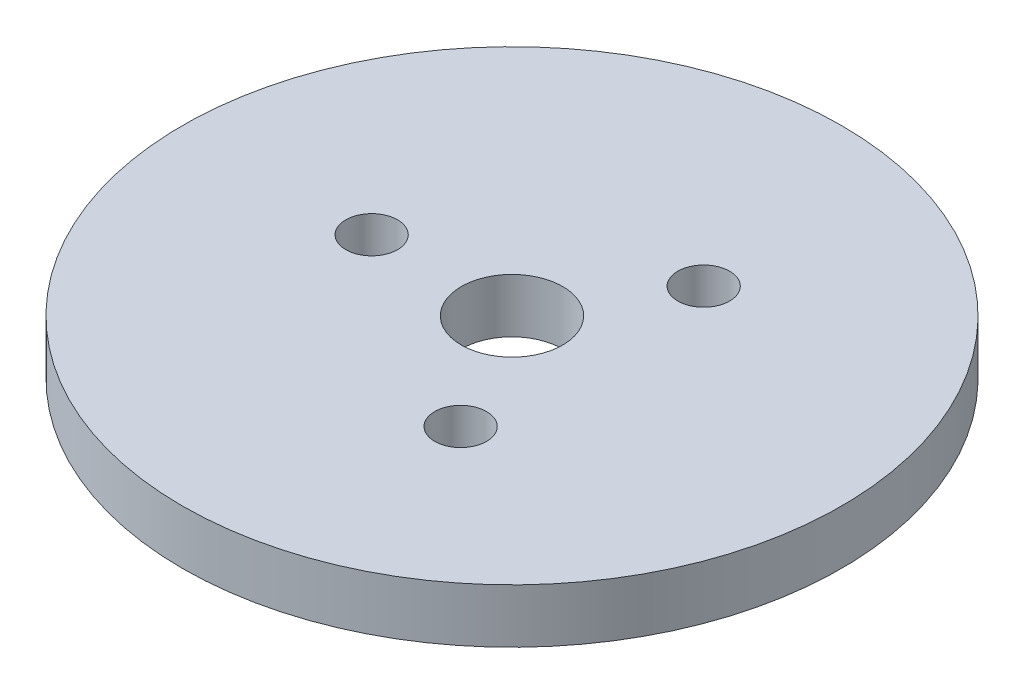
from build123d import *

# Parameters (mm, degrees)
SKETCH1_R           = 97.5
BOSS_EXTRUDE1_DEPTH = 16
SKETCH2_R           = 15
CUT_EXTRUDE1_DEPTH  = 139.811022617
SKETCH3_R           = 7.663290613
CUT_EXTRUDE2_DEPTH  = 11.331991897
CIRPATTERN1_COUNT   = 3


with BuildPart() as part:
    # Sketch1 → Boss-Extrude1 (new body)
    with BuildSketch(Plane(origin=(0, 0, 0), x_dir=(1, 0, 0), z_dir=(0, 1, 0))):
        Circle(SKETCH1_R)
    extrude(amount=BOSS_EXTRUDE1_DEPTH)

    # Sketch2 → Cut-Extrude1 (cut, through all)
    with BuildSketch(Plane(origin=(0, 0, 0), x_dir=(1, 0, 0), z_dir=(0, 1, 0))):
        Circle(SKETCH2_R)
    extrude(amount=CUT_EXTRUDE1_DEPTH, mode=Mode.SUBTRACT)

    # Sketch3 → Cut-Extrude2 (cut)
    with BuildSketch(Plane(origin=(0, 16, 0), x_dir=(1, 0, 0), z_dir=(0, 1, 0))):
        with Locations((-41.520688626, 0)):
            Circle(SKETCH3_R)
    cut_extrude2 = extrude(amount=-CUT_EXTRUDE2_DEPTH, mode=Mode.SUBTRACT)

    # CirPattern1: Cut-Extrude2 ×3 about axis
    cirpattern1_axis = Axis((0, 0, 0), (0, 1, 0))
    for i in range(1, CIRPATTERN1_COUNT):
        add(cut_extrude2.rotate(cirpattern1_axis, i * 360 / CIRPATTERN1_COUNT), mode=Mode.SUBTRACT)


solid = part.part
